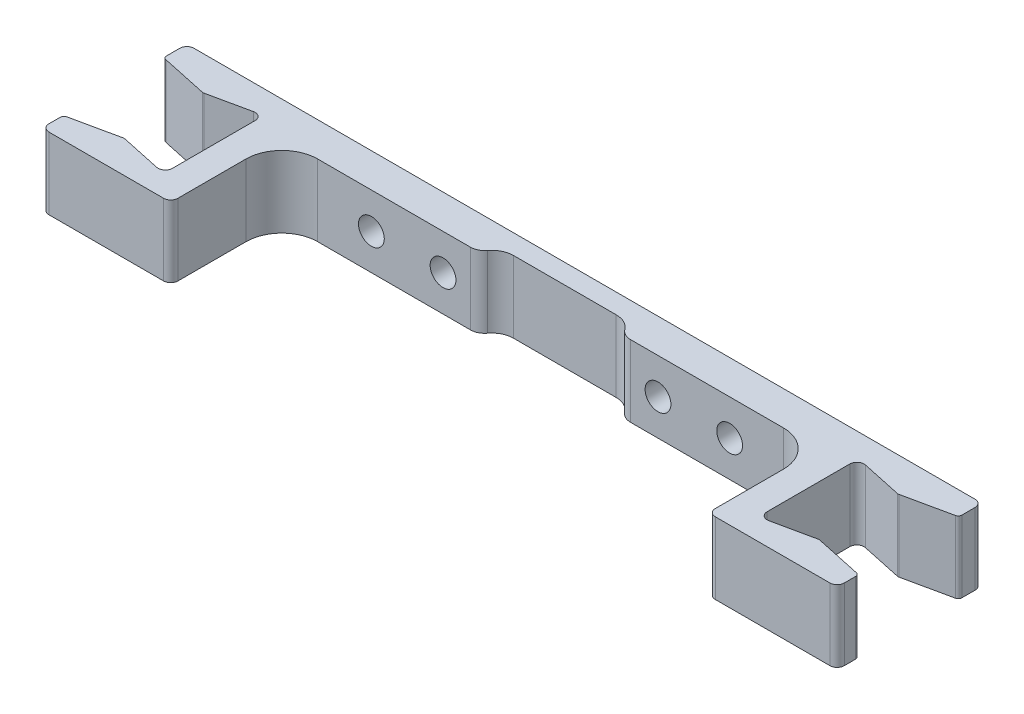
from build123d import *

# Parameters (mm, degrees)
SKETCH_1_W          = 111
SKETCH_1_H          = 10
SKETCH_1_R          = 1.8
EXTRUDE_1_DEPTH     = 4.75
SKETCH_2_W          = 4
SKETCH_2_H          = 10
EXTRUDE_2_DEPTH     = 15.5
SKETCH_3_W          = 4.5
SKETCH_3_H          = 10
EXTRUDE_3_DEPTH     = 14
SKETCH_4_W          = 4.5
SKETCH_4_H          = 10
EXTRUDE_4_DEPTH     = 14
FILLET_1_R          = 5
FILLET_2_R          = 1
SKETCH_5_W          = 20
SKETCH_5_H          = 2
CUT_EXTRUDE_1_DEPTH = 14
FILLET_4_R          = 3
FILLET_5_R          = 2
CUT_EXTRUDE_2_DEPTH = 200
FILLET_6_R          = 0.5
FILLET_7_R          = 1


with BuildPart() as part:
    # ｽｹｯﾁ1 → ﾎﾞｽ - 押し出し1 (new body)
    with BuildSketch(Plane.XY):
        with Locations((0, -111)):
            Rectangle(SKETCH_1_W, SKETCH_1_H)
        with Locations((25, -111)):
            Circle(SKETCH_1_R, mode=Mode.SUBTRACT)
        with Locations((15, -111)):
            Circle(SKETCH_1_R, mode=Mode.SUBTRACT)
        with Locations((-15, -111)):
            Circle(SKETCH_1_R, mode=Mode.SUBTRACT)
        with Locations((-25, -111)):
            Circle(SKETCH_1_R, mode=Mode.SUBTRACT)
    extrude(amount=EXTRUDE_1_DEPTH)

    # ｽｹｯﾁ2 → ﾎﾞｽ - 押し出し2 (add)
    with BuildSketch(Plane.XY.offset(4.75)):
        with Locations((39.5, -111)):
            Rectangle(SKETCH_2_W, SKETCH_2_H)
        with Locations((-39.5, -111)):
            Rectangle(SKETCH_2_W, SKETCH_2_H)
    extrude(amount=EXTRUDE_2_DEPTH)

    # ｽｹｯﾁ3 → ﾎﾞｽ - 押し出し3 (add)
    with BuildSketch(Plane(origin=(41.5, 0, 0), x_dir=(0, 0, -1), z_dir=(1, 0, 0))):
        with Locations((-18, -111)):
            Rectangle(SKETCH_3_W, SKETCH_3_H)
    extrude(amount=EXTRUDE_3_DEPTH)

    # ｽｹｯﾁ4 → ﾎﾞｽ - 押し出し4 (add)
    with BuildSketch(Plane.ZY.offset(41.5)):
        with Locations((18, -111)):
            Rectangle(SKETCH_4_W, SKETCH_4_H)
    extrude(amount=EXTRUDE_4_DEPTH)

    # ﾌｨﾚｯﾄ1
    fillet_1_edges = [part.edges().sort_by_distance(p)[0] for p in [
        (37.5, -111, 4.75),
        (-37.5, -111, 4.75),
    ]]
    fillet(fillet_1_edges, radius=FILLET_1_R)

    # ﾌｨﾚｯﾄ2
    fillet_2_edges = [part.edges().sort_by_distance(p)[0] for p in [
        (37.5, -111, 20.25),
        (-37.5, -111, 20.25),
        (-55.5, -111, 0),
        (55.5, -111, 20.25),
        (55.5, -111, 0),
        (-55.5, -111, 20.25),
    ]]
    fillet(fillet_2_edges, radius=FILLET_2_R)

    # ｽｹｯﾁ5 → ｶｯﾄ - 押し出し1 (cut)
    with BuildSketch(Plane(origin=(0, -106, 0), x_dir=(1, 0, 0), z_dir=(0, 1, 0))):
        with Locations((0, -3.75)):
            Rectangle(SKETCH_5_W, SKETCH_5_H)
    extrude(amount=-CUT_EXTRUDE_1_DEPTH, mode=Mode.SUBTRACT)

    # ﾌｨﾚｯﾄ4
    # the kernel refuses this fillet: 3 mm, written as the material it adds along each edge
    with BuildSketch(Plane(origin=(10, -106, 2.75), x_dir=(-1, 0, 0), z_dir=(0, -1, 0))) as fillet_4_piece_1:
        with BuildLine():
            CenterArc((2.828427125, -3), FILLET_4_R, 90, 70.528779366)
            Line((0, -2), (-0.056568542, -1.98))
            ThreePointArc((-0.056568542, -1.98), (-0.06, -1), (-0.06, 0))
            Line((-0.06, 0), (0, 0.06))
            Line((0, 0.06), (2.828427125, 0.06))
            Line((2.828427125, 0.06), (2.828427125, 0))
        make_face()
    extrude(amount=10)
    with BuildSketch(Plane(origin=(-10, -106, 2.75), x_dir=(0, 0, 1), z_dir=(0, -1, 0))) as fillet_4_piece_2:
        with BuildLine():
            CenterArc((3, -2.828427125), FILLET_4_R, 109.471220634, 70.528779366)
            Line((0, -2.828427125), (-0.06, -2.828427125))
            Line((-0.06, -2.828427125), (-0.06, 0))
            Line((-0.06, 0), (0, 0.06))
            ThreePointArc((0, 0.06), (1, 0.06), (1.98, 0.056568542))
            Line((1.98, 0.056568542), (2, 0))
        make_face()
    extrude(amount=10)

    # ﾌｨﾚｯﾄ5
    fillet_5_edges = [part.edges().sort_by_distance(p)[0] for p in [
        (-10, -111, 4.75),
        (10, -111, 4.75),
    ]]
    fillet(fillet_5_edges, radius=FILLET_5_R)

    # ｽｹｯﾁ6 → ｶｯﾄ - 押し出し2 (cut)
    with BuildSketch(Plane(origin=(0, -106, 0), x_dir=(1, 0, 0), z_dir=(0, 1, 0))):
        Polygon((-55.5, -4.75), (-48.5, -4.75), (-55.5, -3.25), align=None)
        Polygon((-41.5, -4.75), (-41.5, -3.25), (-48.5, -4.75), align=None)
        Polygon((-41.5, -15.75), (-48.5, -15.75), (-41.5, -17.25), align=None)
        Polygon((-55.5, -17.25), (-48.5, -15.75), (-55.5, -15.75), align=None)
        Polygon((55.5, -4.75), (55.5, -3.25), (48.5, -4.75), align=None)
        Polygon((41.5, -4.75), (48.5, -4.75), (41.5, -3.25), align=None)
        Polygon((55.5, -15.75), (48.5, -15.75), (55.5, -17.25), align=None)
        Polygon((41.5, -15.75), (41.5, -17.25), (48.5, -15.75), align=None)
    extrude(amount=-CUT_EXTRUDE_2_DEPTH, mode=Mode.SUBTRACT)

    # ﾌｨﾚｯﾄ6
    fillet_6_edges = [part.edges().sort_by_distance(p)[0] for p in [
        (-55.5, -111, 17.25),
        (48.5, -111, 15.75),
        (-48.5, -111, 4.75),
        (-55.5, -111, 3.25),
        (-48.5, -111, 15.75),
        (48.5, -111, 4.75),
        (55.5, -111, 3.25),
        (55.5, -111, 17.25),
    ]]
    fillet(fillet_6_edges, radius=FILLET_6_R)

    # ﾌｨﾚｯﾄ7
    fillet_7_edges = [part.edges().sort_by_distance(p)[0] for p in [
        (41.5, -111, 17.25),
        (-41.5, -111, 3.25),
        (-41.5, -111, 17.25),
        (41.5, -111, 3.25),
    ]]
    fillet(fillet_7_edges, radius=FILLET_7_R)


solid = part.part
